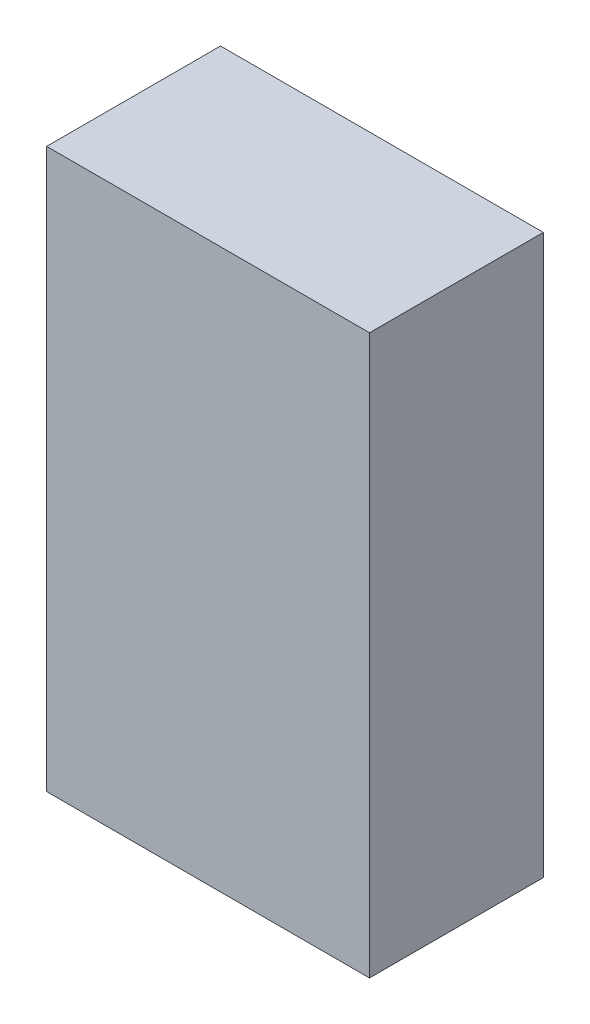
from build123d import *

# Parameters (mm, degrees)
SKETCH_1_W      = 26
SKETCH_1_H      = 45
EXTRUDE_1_DEPTH = 14


with BuildPart() as part:
    # 草图1 → 凸台-拉伸1 (new body)
    with BuildSketch(Plane.XY):
        with Locations((-11.862884841, -45.211686375)):
            Rectangle(SKETCH_1_W, SKETCH_1_H)
    extrude(amount=EXTRUDE_1_DEPTH)


solid = part.part
